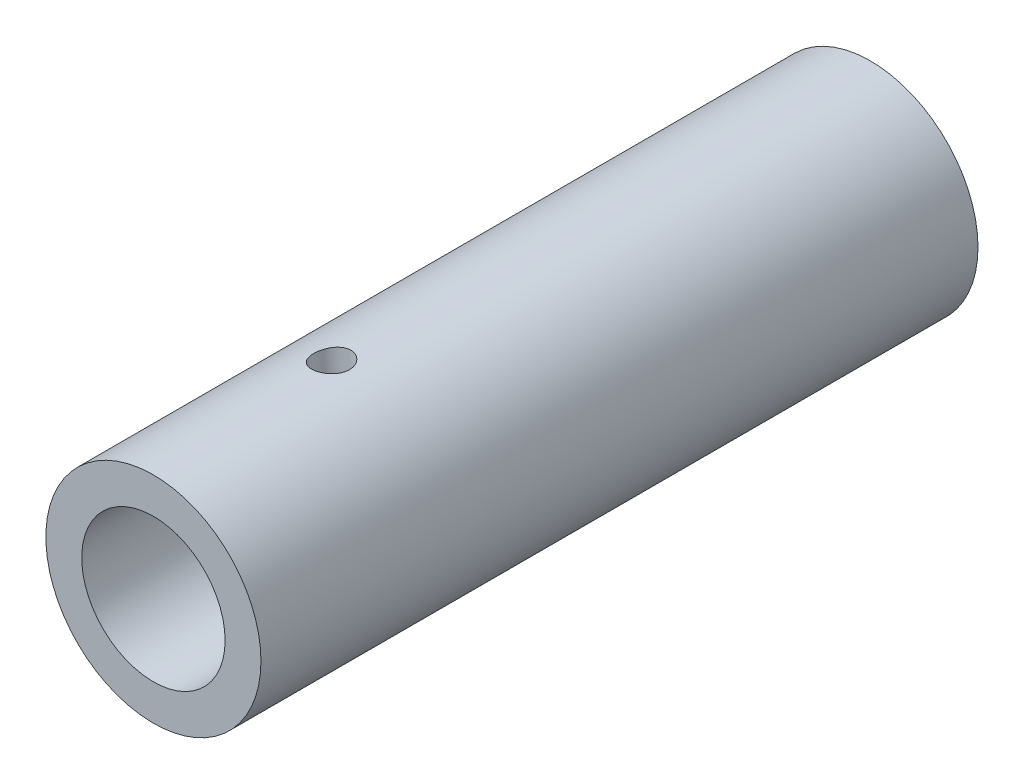
from build123d import *

# Parameters (mm, degrees)
SKETCH1_R           = 9.525
BOSS_EXTRUDE1_DEPTH = 63.5
SKETCH3_R           = 6.35
CUT_EXTRUDE2_DEPTH  = 48.26


# Read off the part's stored shape, not the designer's step: 1/8 (0.125) Diameter Hole1
with BuildPart() as part:
    # Sketch1 → Boss-Extrude1 (new body)
    with BuildSketch(Plane.XY):
        Circle(SKETCH1_R)
    extrude(amount=BOSS_EXTRUDE1_DEPTH)

    # Sketch3 → Cut-Extrude2 (cut)
    with BuildSketch(Plane.XY.offset(63.5)):
        Circle(SKETCH3_R)
    extrude(amount=-CUT_EXTRUDE2_DEPTH, mode=Mode.SUBTRACT)

    # 1/8 (0.125) Diameter Hole1 outline → 1/8 (0.125) Diameter Hole1 (revolve, cut)
    with BuildSketch(Plane(origin=(0, 0, 46.736), x_dir=(0.99452895474108, 0.10446127599074502, 0), z_dir=(0, 0, -1))):
        Polygon((1.5875, -9.525019471), (1.5875, -6.35), (1.346904209, -6.205435464), (0, -6.205435464), (0, -9.525019471), align=None)
    revolve(axis=Axis((0, 0, 46.736), (0.10446127599074502, -0.99452895474108, 0)), mode=Mode.SUBTRACT)

    # Sketch11 → 1/4 NPT Tapped Hole1 (revolve, cut)
    with BuildSketch(Plane.YZ):
        Polygon((0, 0), (0, 19.852347279), (5.5626, 16.51), (5.5626, 12.7), (5.943684593, 12.7), (6.3239396, 0), align=None)
    revolve(axis=Axis((0, 0, -6.35), (0, 0, 1)), mode=Mode.SUBTRACT)


solid = part.part
